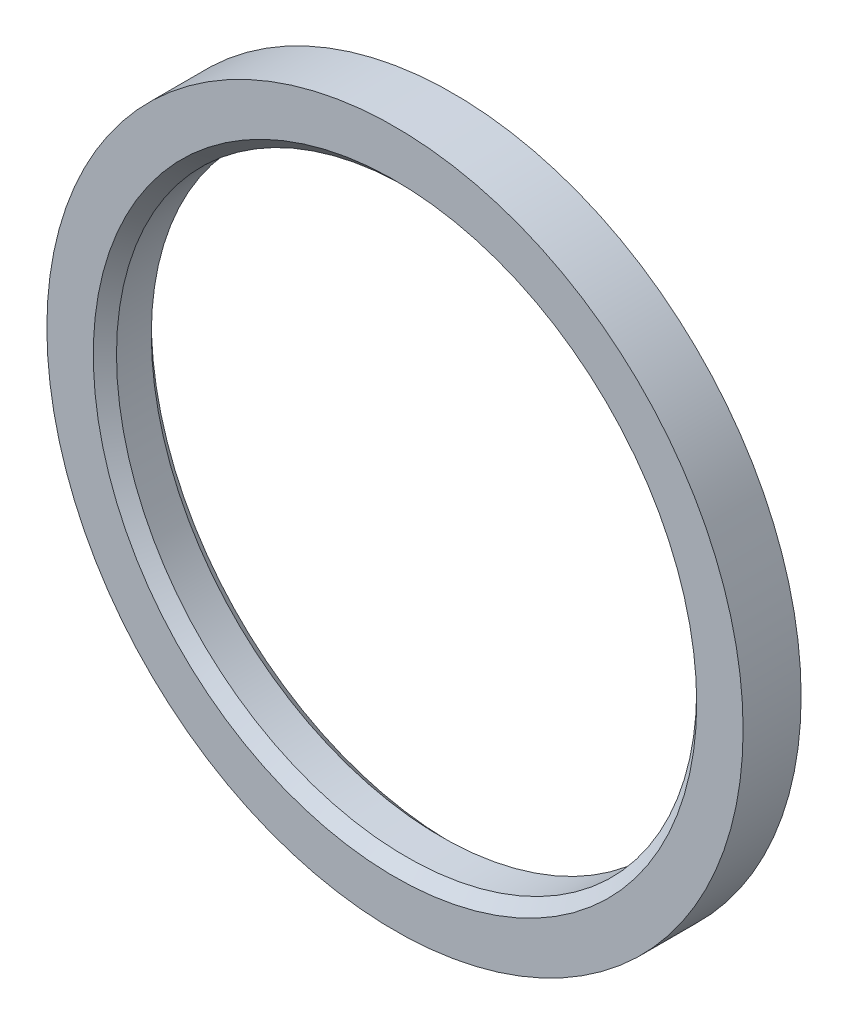
from build123d import *

# Parameters (mm, degrees)
SKETCH_1_R      = 6
SKETCH_1_R_2    = 5
EXTRUDE_1_DEPTH = 1
CHAMFER_1_SIZE  = 0.2


with BuildPart() as part:
    # 草图1 → 凸台-拉伸1 (new body)
    with BuildSketch(Plane.XY):
        Circle(SKETCH_1_R)
        Circle(SKETCH_1_R_2, mode=Mode.SUBTRACT)
    extrude(amount=EXTRUDE_1_DEPTH)

    # 倒角1
    chamfer_1_edges = [part.edges().sort_by_distance(p)[0] for p in [
        (-5, 0, 0),
        (-5, 0, 1),
    ]]
    chamfer(chamfer_1_edges, length=CHAMFER_1_SIZE)


solid = part.part
